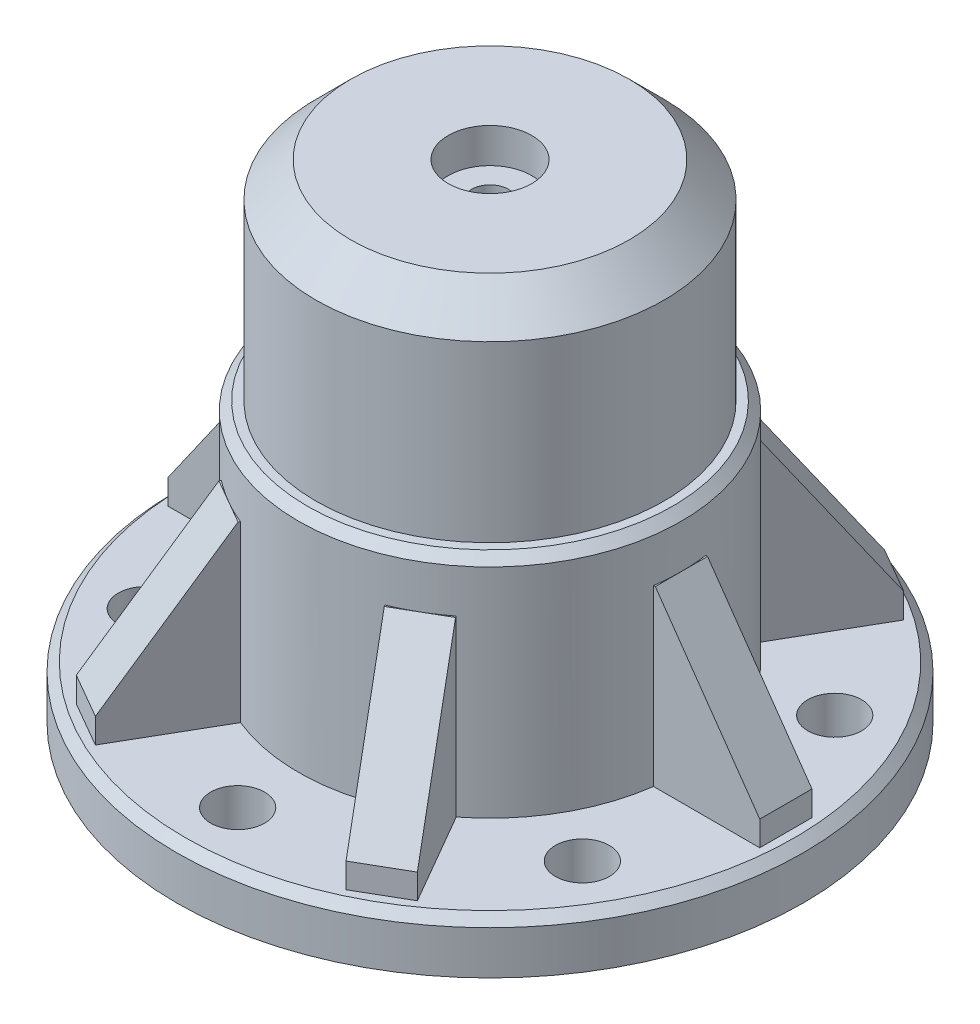
from build123d import *

# Parameters (mm, degrees)
SKETCH1_R                = 18
SKETCH1_R_2              = 8
BOSS_EXTRUDE1_DEPTH      = 3
SKETCH2_R                = 11
SKETCH2_R_2              = 8
BOSS_EXTRUDE2_DEPTH      = 22
M_0_295_DIAMETER_HOLE1_D = 3.099999896
BOSS_EXTRUDE3_DEPTH      = 1.5
CIRPATTERN1_COUNT        = 6
CHAMFER2_SIZE            = 0.5
SKETCH6_R                = 11
BOSS_EXTRUDE4_DEPTH      = 3
BOSS_EXTRUDE5_START      = 2
SKETCH8_R                = 8
BOSS_EXTRUDE5_DEPTH      = 2
CHAMFER3_SIZE            = 3
SKETCH7_R                = 2.4
CUT_EXTRUDE1_DEPTH       = 2
CUT_EXTRUDE2_REACH       = 38.387
SKETCH9_R                = 1.05
CUT_EXTRUDE3_START       = -12
SKETCH10_R               = 11
SKETCH10_R_2             = 10
CUT_EXTRUDE3_DEPTH       = 12
CHAMFER4_SIZE            = 0.5


with BuildPart() as part:
    # Sketch1 → Boss-Extrude1 (new body)
    with BuildSketch(Plane(origin=(0, 0, 0), x_dir=(1, 0, 0), z_dir=(0, 1, 0))):
        Circle(SKETCH1_R)
        Circle(SKETCH1_R_2, mode=Mode.SUBTRACT)
    extrude(amount=BOSS_EXTRUDE1_DEPTH)

    # Sketch2 → Boss-Extrude2 (add)
    with BuildSketch(Plane(origin=(0, 3, 0), x_dir=(1, 0, 0), z_dir=(0, 1, 0))):
        Circle(SKETCH2_R)
        Circle(SKETCH2_R_2, mode=Mode.SUBTRACT)
    extrude(amount=BOSS_EXTRUDE2_DEPTH)

    # M (0.295) Diameter Hole1 (through all)
    with Locations(Plane(origin=(0, 3, 14.5), x_dir=(0, 0, 1), z_dir=(0, 1, 0))):
        with Locations((0, 0), (-7.25, -12.557368355), (-7.25, 12.557368355), (-21.75, 12.557368355), (-29, 0), (-21.75, -12.557368355)):
            Hole(M_0_295_DIAMETER_HOLE1_D / 2)

    # Sketch5 → Boss-Extrude3 (add, symmetric)
    with BuildSketch(Plane.XY):
        Polygon((11, 13), (17, 4.428571429), (17, 3), (17, 2.5), (10.5, 2.5), (10.5, 13), align=None)
    boss_extrude3 = extrude(amount=BOSS_EXTRUDE3_DEPTH, both=True)

    # CirPattern1: Boss-Extrude3 ×6 about axis
    cirpattern1_axis = Axis((0, 18, 0), (0, -1, 0))
    for i in range(1, CIRPATTERN1_COUNT):
        add(boss_extrude3.rotate(cirpattern1_axis, i * 360 / CIRPATTERN1_COUNT))

    # Chamfer2
    chamfer2_edges = [part.edges().sort_by_distance(p)[0] for p in [
        (-18, 3, 0),
    ]]
    chamfer(chamfer2_edges, length=CHAMFER2_SIZE)

    # Sketch6 → Boss-Extrude4 (add)
    with BuildSketch(Plane(origin=(0, 25, 0), x_dir=(1, 0, 0), z_dir=(0, 1, 0))):
        Circle(SKETCH6_R)
    extrude(amount=BOSS_EXTRUDE4_DEPTH)

    # Sketch8 → Boss-Extrude5 (add)
    with BuildSketch(Plane.XZ.offset(-25).offset(BOSS_EXTRUDE5_START)):
        Circle(SKETCH8_R)
    extrude(amount=-BOSS_EXTRUDE5_DEPTH)

    # Chamfer3
    chamfer3_edges = [part.edges().sort_by_distance(p)[0] for p in [
        (-11, 28, 0),
        (-8, 23, 0),
    ]]
    chamfer(chamfer3_edges, length=CHAMFER3_SIZE)

    # Sketch7 → Cut-Extrude1 (cut)
    with BuildSketch(Plane(origin=(0, 28, 0), x_dir=(1, 0, 0), z_dir=(0, 1, 0))):
        Circle(SKETCH7_R)
    extrude(amount=-CUT_EXTRUDE1_DEPTH, mode=Mode.SUBTRACT)

    # Sketch9 → Cut-Extrude2 (cut, up to next)
    with BuildSketch(Plane(origin=(0, 26, 0), x_dir=(1, 0, 0), z_dir=(0, 1, 0)), mode=Mode.PRIVATE) as cut_extrude2_sk1:
        Circle(SKETCH9_R)
    cut_extrude2_tool1 = extrude(cut_extrude2_sk1.sketch, amount=-CUT_EXTRUDE2_REACH, mode=Mode.PRIVATE) & part.part
    add(cut_extrude2_tool1.solids().sort_by_distance((0, 26, 0))[0], mode=Mode.SUBTRACT)

    # Sketch10 → Cut-Extrude3 (cut)
    with BuildSketch(Plane(origin=(0, 28, 0), x_dir=(1, 0, 0), z_dir=(0, 1, 0)).offset(CUT_EXTRUDE3_START)):
        Circle(SKETCH10_R)
        Circle(SKETCH10_R_2, mode=Mode.SUBTRACT)
    extrude(amount=CUT_EXTRUDE3_DEPTH, mode=Mode.SUBTRACT)

    # Chamfer4
    chamfer4_edges = [part.edges().sort_by_distance(p)[0] for p in [
        (-11, 16, 0),
    ]]
    chamfer(chamfer4_edges, length=CHAMFER4_SIZE)


solid = part.part
